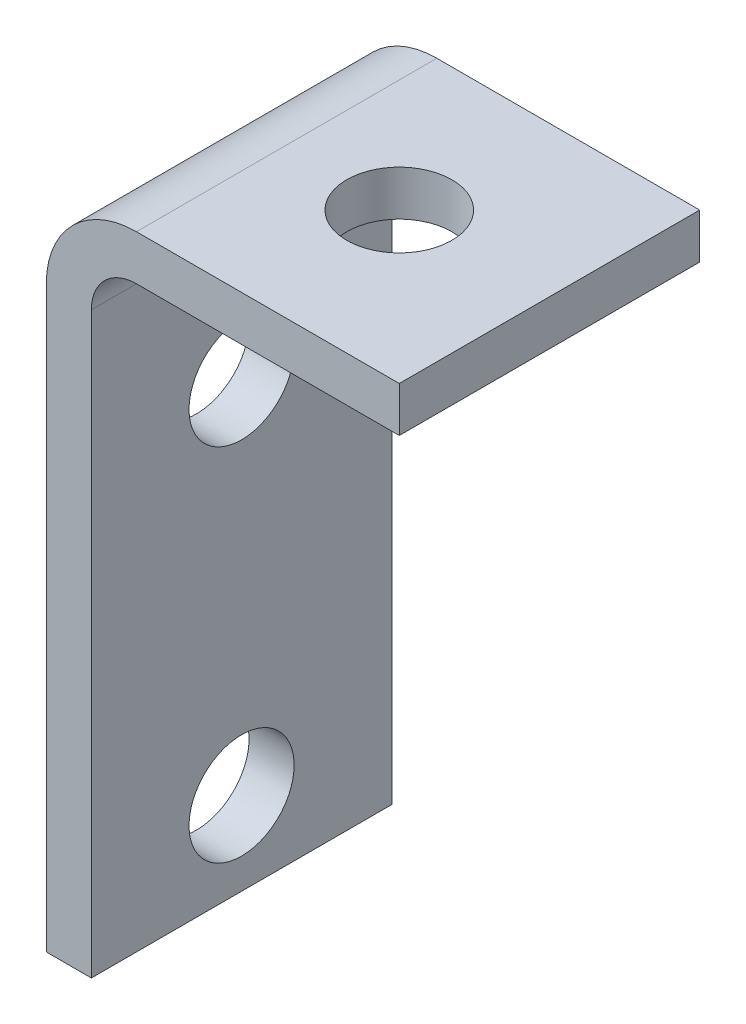
from build123d import *

# Parameters (mm, degrees)
BASE_FLANGE1_DEPTH             = 40
CUT_EXTRUDE1_DEPTH             = 109.350745652
F_14_0_14_DIAMETER_HOLE1_D     = 14
F_14_0_14_DIAMETER_HOLE1_DEPTH = 47
F_14_0_14_DIAMETER_HOLE2_D     = 14


# Sheet-metal steps are written as plain solids
with BuildPart() as part:
    # Sketch7 → Base-Flange1 (new body)
    with BuildSketch(Plane.XY):
        with BuildLine():
            Line((0, 0), (47, 0))
            Line((47, 0), (47, 89.055511246))
            Line((47, 89.055511246), (12, 89.055511246))
            ThreePointArc((12, 89.055511246), (3.514718626, 85.54079262), (0, 77.055511246))
            Line((0, 77.055511246), (0, 0))
        make_face()
    extrude(amount=-BASE_FLANGE1_DEPTH)

    # Sketch10 → Cut-Extrude1 (cut, through all)
    with BuildSketch(Plane(origin=(0, 0, -40), x_dir=(-1, 0, 0), z_dir=(0, 0, -1))):
        with BuildLine():
            Line((-12, 83.055511246), (-47, 83.055511246))
            Line((-47, 83.055511246), (-47, 0))
            Line((-47, 0), (-6, 0))
            Line((-6, 0), (-6, 77.055511246))
            ThreePointArc((-6, 77.055511246), (-7.757359313, 81.298151933), (-12, 83.055511246))
        make_face()
    extrude(amount=-CUT_EXTRUDE1_DEPTH, mode=Mode.SUBTRACT)

    # Ø14.0 (14) Diameter Hole1
    with Locations(Plane.ZY):
        with Locations((-20, 59.055511246), (-20, 11.055511246)):
            Hole(F_14_0_14_DIAMETER_HOLE1_D / 2, depth=F_14_0_14_DIAMETER_HOLE1_DEPTH)

    # Ø14.0 (14) Diameter Hole2 (through all)
    with Locations(Plane(origin=(0, 83.055511246, 0), x_dir=(-1, 0, 0), z_dir=(0, -1, 0))):
        with Locations((-27, 20)):
            Hole(F_14_0_14_DIAMETER_HOLE2_D / 2)


solid = part.part
